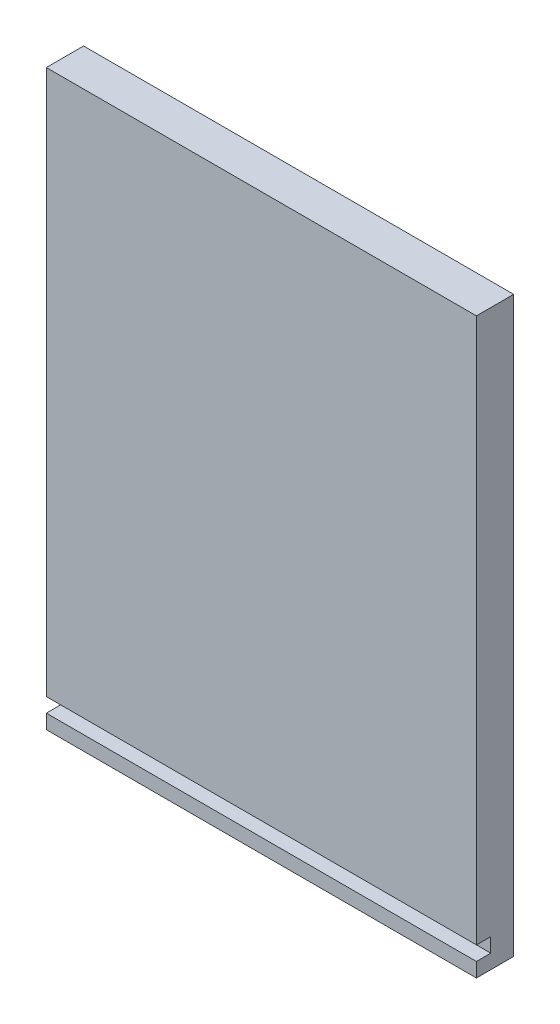
from build123d import *

# Parameters (mm, degrees)
SKETCH_1_W          = 150
SKETCH_1_H          = 200
EXTRUDE_1_DEPTH     = 13
SKETCH_2_W          = 150
SKETCH_2_H          = 5
CUT_EXTRUDE_1_DEPTH = 5


with BuildPart() as part:
    # ｽｹｯﾁ1 → ﾎﾞｽ - 押し出し1 (new body)
    with BuildSketch(Plane.XY):
        with Locations((21.019868277, 33.335714286)):
            Rectangle(SKETCH_1_W, SKETCH_1_H)
    extrude(amount=EXTRUDE_1_DEPTH)

    # ｽｹｯﾁ2 → ｶｯﾄ - 押し出し1 (cut)
    with BuildSketch(Plane.XY.offset(13)):
        with Locations((21.019868277, -59.164285714)):
            Rectangle(SKETCH_2_W, SKETCH_2_H)
    extrude(amount=-CUT_EXTRUDE_1_DEPTH, mode=Mode.SUBTRACT)


solid = part.part
